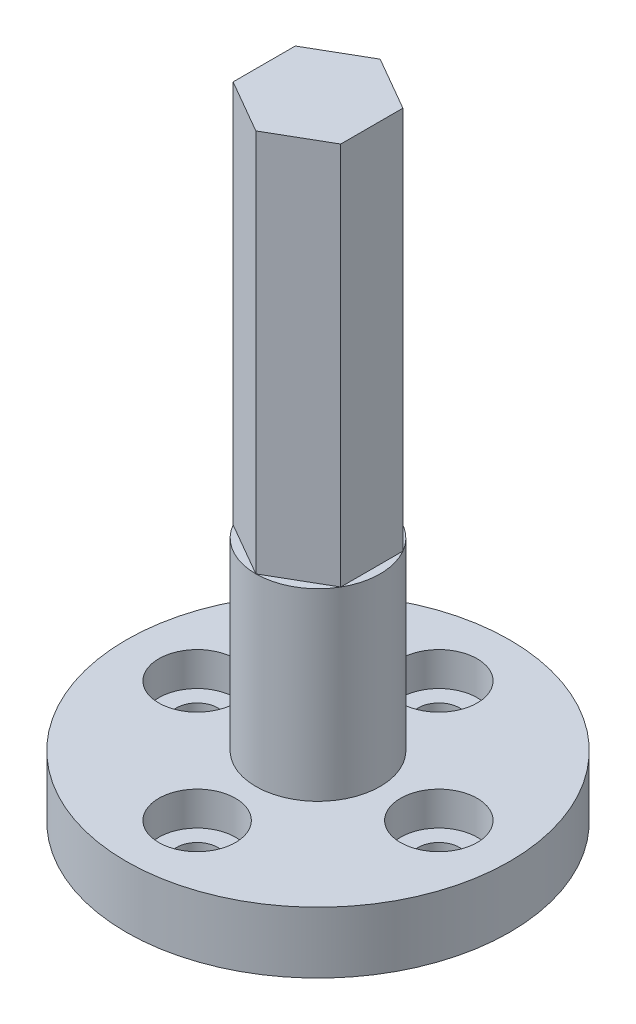
from build123d import *

# Parameters (mm, degrees)
CROQUIS3_R              = 12.5
SALIENTE_EXTRUIR1_DEPTH = 4
CROQUIS4_R              = 4.05
SALIENTE_EXTRUIR2_DEPTH = 37
CROQUIS12_OUTSIDE_W     = 37.828
CROQUIS12_OUTSIDE_H     = 37.828
CORTAR_EXTRUIR7_DEPTH   = 25
CROQUIS13_R             = 1.35
CORTAR_EXTRUIR8_DEPTH   = 10
CROQUIS14_R             = 2.5
CORTAR_EXTRUIR9_DEPTH   = 2.2


with BuildPart() as part:
    # Croquis3 → Saliente-Extruir1 (new body)
    with BuildSketch(Plane(origin=(0, 0, 0), x_dir=(1, 0, 0), z_dir=(0, 1, 0))):
        Circle(CROQUIS3_R)
    extrude(amount=SALIENTE_EXTRUIR1_DEPTH)

    # Croquis4 → Saliente-Extruir2 (add)
    with BuildSketch(Plane(origin=(0, 4, 0), x_dir=(1, 0, 0), z_dir=(0, 1, 0))):
        Circle(CROQUIS4_R)
    extrude(amount=SALIENTE_EXTRUIR2_DEPTH)

    # Croquis12 outside → Cortar-Extruir7 (cut)
    with BuildSketch(Plane(origin=(0, 41, 0), x_dir=(1, 0, 0), z_dir=(0, 1, 0))):
        Rectangle(CROQUIS12_OUTSIDE_W, CROQUIS12_OUTSIDE_H)
        Polygon((0, 4.05), (-3.507402885, 2.025), (-3.507402885, -2.025), (0, -4.05), (3.507402885, -2.025), (3.507402885, 2.025), align=None, mode=Mode.SUBTRACT)
    extrude(amount=-CORTAR_EXTRUIR7_DEPTH, mode=Mode.SUBTRACT)

    # Croquis13 → Cortar-Extruir8 (cut)
    with BuildSketch(Plane.XZ):
        with Locations((0, 7.875)):
            Circle(CROQUIS13_R)
        with Locations((7.875, 0)):
            Circle(CROQUIS13_R)
        with Locations((0, -7.875)):
            Circle(CROQUIS13_R)
        with Locations((-7.875, 0)):
            Circle(CROQUIS13_R)
    extrude(amount=-CORTAR_EXTRUIR8_DEPTH, mode=Mode.SUBTRACT)

    # Croquis14 → Cortar-Extruir9 (cut)
    with BuildSketch(Plane(origin=(0, 4, 0), x_dir=(1, 0, 0), z_dir=(0, 1, 0))):
        with Locations((0, 7.875)):
            Circle(CROQUIS14_R)
        with Locations((7.875, 0)):
            Circle(CROQUIS14_R)
        with Locations((0, -7.875)):
            Circle(CROQUIS14_R)
        with Locations((-7.875, 0)):
            Circle(CROQUIS14_R)
    extrude(amount=-CORTAR_EXTRUIR9_DEPTH, mode=Mode.SUBTRACT)


solid = part.part
